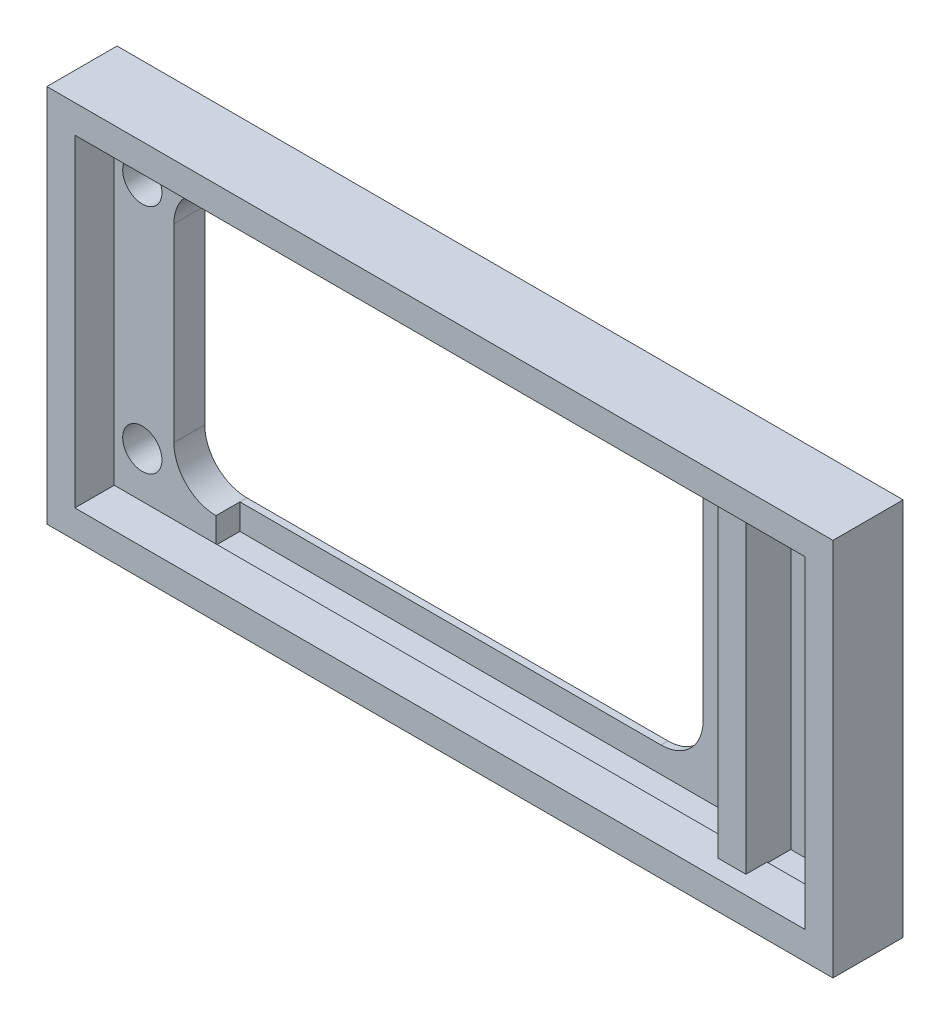
from build123d import *

# Parameters (mm, degrees)
SKETCH1_W           = 56
SKETCH1_H           = 27
SKETCH1_W_2         = 52
SKETCH1_H_2         = 23
BOSS_EXTRUDE1_DEPTH = 5
SKETCH2_W           = 56
SKETCH2_H           = 27
SKETCH2_R           = 1.4
BOSS_EXTRUDE2_DEPTH = 2.2
SKETCH3_W           = 44.75
SKETCH3_H           = 23.07193706
CUT_EXTRUDE1_DEPTH  = 1.7
FILLET1_R           = 1
SKETCH5_W           = 2
SKETCH5_H           = 23.07193706
BOSS_EXTRUDE3_DEPTH = 3.2


with BuildPart() as part:
    # Sketch1 → Boss-Extrude1 (new body)
    with BuildSketch(Plane.XY):
        Rectangle(SKETCH1_W, SKETCH1_H)
        Rectangle(SKETCH1_W_2, SKETCH1_H_2, mode=Mode.SUBTRACT)
    extrude(amount=BOSS_EXTRUDE1_DEPTH)

    # Sketch2 → Boss-Extrude2 (add)
    with BuildSketch(Plane(origin=(0, 0, 0), x_dir=(-1, 0, 0), z_dir=(0, 0, -1))):
        Rectangle(SKETCH2_W, SKETCH2_H)
        with Locations((24, 8.25)):
            Circle(SKETCH2_R, mode=Mode.SUBTRACT)
        with Locations((24, -8.25)):
            Circle(SKETCH2_R, mode=Mode.SUBTRACT)
        with Locations((-24, 8.25)):
            Circle(SKETCH2_R, mode=Mode.SUBTRACT)
        with Locations((-24, -8.25)):
            Circle(SKETCH2_R, mode=Mode.SUBTRACT)
        with BuildLine():
            Line((-11.25, -9.75), (18.75, -9.75))
            ThreePointArc((18.75, -9.75), (20.871320344, -8.871320344), (21.75, -6.75))
            Line((21.75, -6.75), (21.75, 6.75))
            ThreePointArc((21.75, 6.75), (20.871320344, 8.871320344), (18.75, 9.75))
            Line((18.75, 9.75), (-11.25, 9.75))
            ThreePointArc((-11.25, 9.75), (-13.371320344, 8.871320344), (-14.25, 6.75))
            Line((-14.25, 6.75), (-14.25, -6.75))
            ThreePointArc((-14.25, -6.75), (-13.371320344, -8.871320344), (-11.25, -9.75))
        make_face(mode=Mode.SUBTRACT)
    extrude(amount=-BOSS_EXTRUDE2_DEPTH)

    # Sketch3 → Cut-Extrude1 (cut)
    with BuildSketch(Plane.XY.offset(2.2)):
        with Locations((3.625, -0.03596853)):
            Rectangle(SKETCH3_W, SKETCH3_H)
    extrude(amount=-CUT_EXTRUDE1_DEPTH, mode=Mode.SUBTRACT)

    # Fillet1
    fillet1_edges = [part.edges().sort_by_distance(p)[0] for p in [
        (-18.75, 10.625, 2.2),
    ]]
    fillet(fillet1_edges, radius=FILLET1_R)

    # Sketch5 → Boss-Extrude3 (add)
    with BuildSketch(Plane.XY.offset(0.5)):
        with Locations((19.5, -0.03596853)):
            Rectangle(SKETCH5_W, SKETCH5_H)
    extrude(amount=BOSS_EXTRUDE3_DEPTH)


solid = part.part
